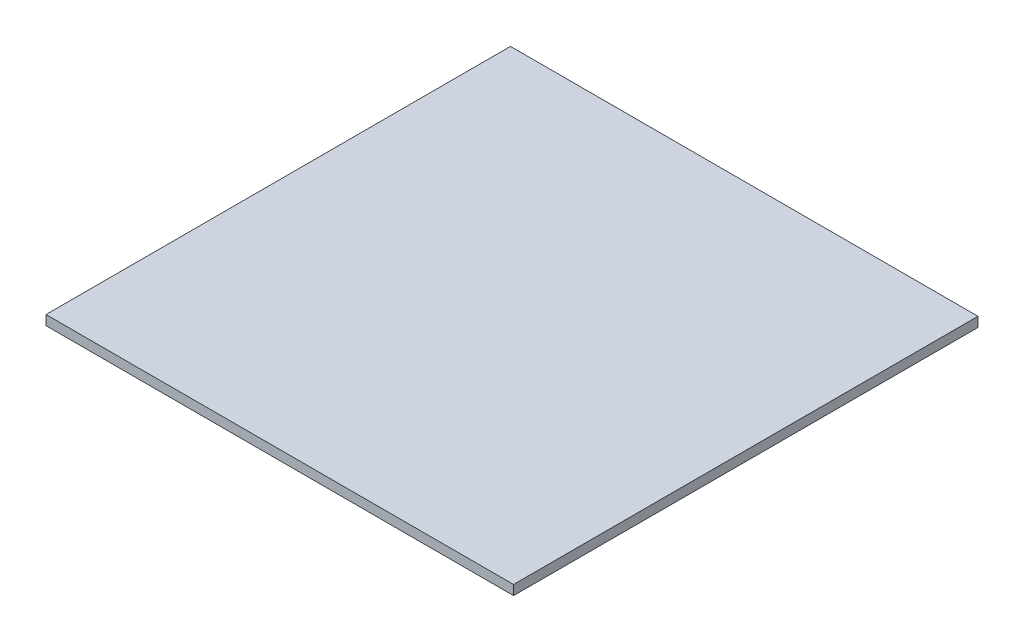
from build123d import *

# Parameters (mm, degrees)
SKETCH2_R           = 60
BOSS_EXTRUDE1_DEPTH = 36
SKETCH3_W           = 290
SKETCH3_H           = 288.108481542
BOSS_EXTRUDE2_DEPTH = 6


with BuildPart() as part:
    # Sketch2 → Boss-Extrude1 (new body)
    with BuildSketch(Plane(origin=(0, 0, 0), x_dir=(1, 0, 0), z_dir=(0, 1, 0))):
        Circle(SKETCH2_R)
    extrude(amount=BOSS_EXTRUDE1_DEPTH)

    # Sketch3 → Boss-Extrude2 (add)
    with BuildSketch(Plane(origin=(0, 36, 0), x_dir=(1, 0, 0), z_dir=(0, 1, 0))):
        with Locations((2.188950162, 6.70342298)):
            Rectangle(SKETCH3_W, SKETCH3_H)
    extrude(amount=BOSS_EXTRUDE2_DEPTH)


solid = part.part
